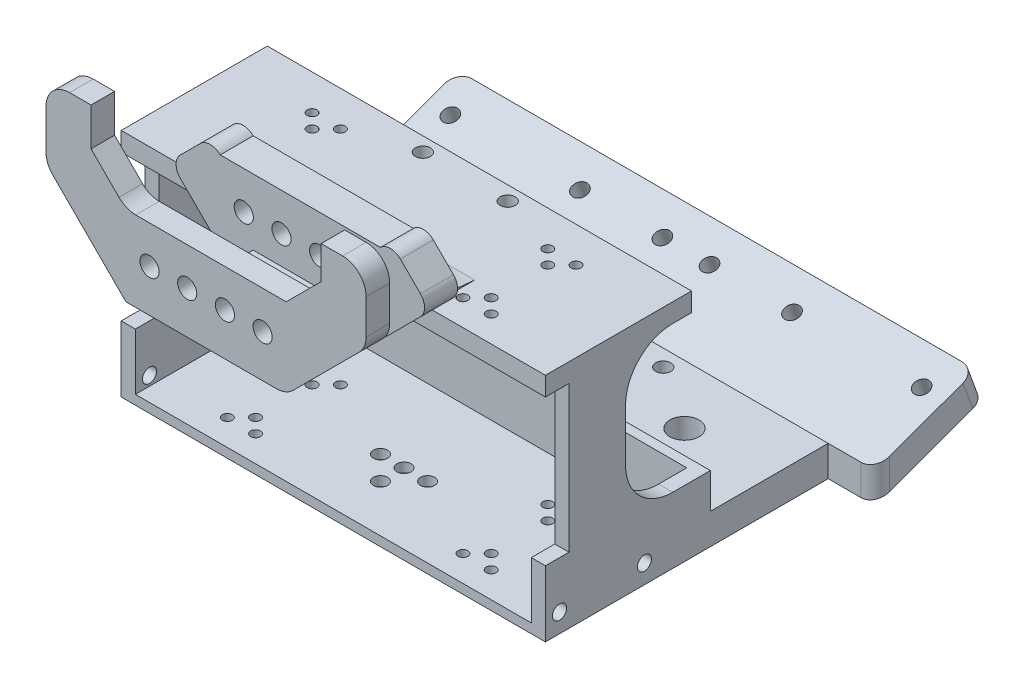
from build123d import *

# Parameters (mm, degrees)
EXTRUDE_1_DEPTH          = 4
EXTRUDE_2_DEPTH          = 7
EXTRUDE_3_DEPTH          = 15
EXTRUDE_4_DEPTH          = 5
CUT_EXTRUDE_2_REACH      = 93.694
SKETCH_6_R               = 2.03
EXTRUDE_5_DEPTH          = 31
EXTRUDE_6_DEPTH          = 12
EXTRUDE_7_DEPTH          = 2
CUT_EXTRUDE_3_DEPTH      = 103.59409284410384
CUT_EXTRUDE_3_DEPTH_BACK = 103.59409284410384
SKETCH_14_R              = 1.049999999999995
SKETCH_14_R_2            = 1.0499999999999985
SKETCH_14_R_3            = 1.049999999999999
SKETCH_14_R_4            = 1.0499999999999987
SKETCH_14_R_5            = 1.050000000000002
SKETCH_14_R_6            = 1.0499999999999916
FILLET_3_R               = 10
FILLET_5_R               = 5
FILLET_9_R               = 3
CUT_EXTRUDE_4_REACH      = 85.223
SKETCH_16_W              = 90.00000000000001
SKETCH_16_H              = 15
EXTRUDE_8_DEPTH          = 25
CUT_EXTRUDE_6_REACH      = 104.594
SKETCH_22_R              = 1.4999999999999998
SKETCH_22_R_2            = 1.4999999999999996
SKETCH_25_R              = 1.6000000000000019
CUT_EXTRUDE_7_DEPTH      = 4
EXTRUDE_10_DEPTH         = 20
EXTRUDE_11_DEPTH         = 55
CUT_EXTRUDE_8_REACH      = 123.772
SKETCH_31_R              = 1.5999999999999974
SKETCH_31_R_2            = 1.5999999999999983
SKETCH_31_R_3            = 1.6000000000000008
CUT_EXTRUDE_9_REACH      = 110.259
SKETCH_32_R              = 1.5999999999999992
SKETCH_32_R_2            = 1.6
SKETCH_32_R_3            = 1.6000000000000019
SKETCH_32_R_4            = 1.6000000000000008
SKETCH_32_R_5            = 3.0999999999999996
SKETCH_32_R_6            = 3.0999999999999983
FILLET_12_R              = 3
SKETCH_33_R              = 1.5000000000000004
SKETCH_33_R_2            = 1.5000000000000009
CUT_EXTRUDE_10_DEPTH     = 126.23705616521259


with BuildPart() as part:
    # 草图1 → 凸台-拉伸1 (new body)
    with BuildSketch(Plane(origin=(0, 0, 0), x_dir=(1, 0, 0), z_dir=(0, 1, 0))):
        Polygon((-45.000000000000014, 23), (44.999999999999986, 23), (45, -23), (-45.00000000000001, -23), align=None)
    extrude(amount=EXTRUDE_1_DEPTH)

    # 草图3 → 凸台-拉伸2 (add)
    with BuildSketch(Plane.XY.offset(23)):
        Polygon((-17, 0), (17, 0), (27.606601717798192, 10.606601717798231), (19.10660171779818, 19.106601717798203), (16.999999999999996, 17), (-17.000000000000004, 17), (-19.10660171779818, 19.106601717798203), (-27.606601717798192, 10.606601717798231), align=None)
    extrude(amount=EXTRUDE_2_DEPTH)

    # 草图4 → 凸台-拉伸3 (add)
    with BuildSketch(Plane.XY.offset(30)):
        Polygon((-9.999999999999934, 3.000000000000002), (10.000000000000068, 3.0000000000000013), (10.000000000000068, -1.8e-16), (-9.999999999999932, 1.07e-15), align=None)
    extrude(amount=EXTRUDE_3_DEPTH)

    # 草图5 → 凸台-拉伸4 (add)
    with BuildSketch(Plane.XY.offset(45)):
        Polygon((-33.9632034355964, 25.46320343559641), (-33.963203435596405, 32.46320343559642), (-24.4099025766973, 32.46320343559642), (-24.409902576697295, 24.409902576697302), (-19.10660171779818, 19.106601717798203), (-17.000000000000004, 17), (16.999999999999996, 17), (19.10660171779818, 19.106601717798203), (24.409902576697277, 24.40990257669732), (24.40990257669728, 31.40990257669732), (33.963203435596384, 31.40990257669732), (33.96320343559638, 25.463203435596437), (33.96320343559638, 16.963203435596416), (27.606601717798192, 10.606601717798231), (17, 0), (-17, 0), (-27.606601717798178, 10.60660171779821), (-33.9632034355964, 16.963203435596423), align=None)
    extrude(amount=EXTRUDE_4_DEPTH)

    # 切除-拉伸2: up to this face of the body (flat: up to its plane)
    cut_extrude_2_end = Plane(part.part.faces().sort_by_distance((0, 10.613576842, 23))[0])
    # 草图6 → 切除-拉伸2 (cut, up to the picked face)
    with BuildSketch(Plane.XY.offset(49.99999999999999), mode=Mode.PRIVATE) as cut_extrude_2_sk1:
        with Locations((-12.000000000000004, 9)):
            Circle(SKETCH_6_R)
    cut_extrude_2_tool1 = split(extrude(cut_extrude_2_sk1.sketch, amount=-CUT_EXTRUDE_2_REACH, mode=Mode.PRIVATE), bisect_by=cut_extrude_2_end, keep=Keep.BOTH, mode=Mode.PRIVATE)
    # 草图6 → 切除-拉伸2 (cut, up to the picked face)
    with BuildSketch(Plane.XY.offset(49.99999999999999), mode=Mode.PRIVATE) as cut_extrude_2_sk2:
        with Locations((-4.0000000000000036, 9)):
            Circle(SKETCH_6_R)
    cut_extrude_2_tool2 = split(extrude(cut_extrude_2_sk2.sketch, amount=-CUT_EXTRUDE_2_REACH, mode=Mode.PRIVATE), bisect_by=cut_extrude_2_end, keep=Keep.BOTH, mode=Mode.PRIVATE)
    # 草图6 → 切除-拉伸2 (cut, up to the picked face)
    with BuildSketch(Plane.XY.offset(49.99999999999999), mode=Mode.PRIVATE) as cut_extrude_2_sk3:
        with Locations((3.9999999999999964, 9)):
            Circle(SKETCH_6_R)
    cut_extrude_2_tool3 = split(extrude(cut_extrude_2_sk3.sketch, amount=-CUT_EXTRUDE_2_REACH, mode=Mode.PRIVATE), bisect_by=cut_extrude_2_end, keep=Keep.BOTH, mode=Mode.PRIVATE)
    # 草图6 → 切除-拉伸2 (cut, up to the picked face)
    with BuildSketch(Plane.XY.offset(49.99999999999999), mode=Mode.PRIVATE) as cut_extrude_2_sk4:
        with Locations((11.999999999999996, 9)):
            Circle(SKETCH_6_R)
    cut_extrude_2_tool4 = split(extrude(cut_extrude_2_sk4.sketch, amount=-CUT_EXTRUDE_2_REACH, mode=Mode.PRIVATE), bisect_by=cut_extrude_2_end, keep=Keep.BOTH, mode=Mode.PRIVATE)
    add(cut_extrude_2_tool1.solids().sort_by(Axis((-12, 9, 50), (0, 0, -1)))[0], mode=Mode.SUBTRACT)
    add(cut_extrude_2_tool2.solids().sort_by(Axis((-4, 9, 50), (0, 0, -1)))[0], mode=Mode.SUBTRACT)
    add(cut_extrude_2_tool3.solids().sort_by(Axis((4, 9, 50), (0, 0, -1)))[0], mode=Mode.SUBTRACT)
    add(cut_extrude_2_tool4.solids().sort_by(Axis((12, 9, 50), (0, 0, -1)))[0], mode=Mode.SUBTRACT)

    # 草图11 → 凸台-拉伸5 (add)
    with BuildSketch(Plane.XZ):
        Polygon((-45.000000000000014, 17.999999999999996), (-42.00000000000001, 18), (-42.00000000000001, 5.999999999999995), (-45.000000000000014, 5.999999999999995), align=None)
        Polygon((45.000000000000014, 6.000000000000006), (42.00000000000001, 6.000000000000005), (42.00000000000001, 18.00000000000001), (45.000000000000014, 18.000000000000007), align=None)
    extrude(amount=EXTRUDE_5_DEPTH)

    # 草图12 → 凸台-拉伸6 (add)
    with BuildSketch(Plane.XZ.offset(31)):
        Polygon((42.00000000000001, 23.000000000000004), (42, -10.000000000000004), (-42, -10.000000000000004), (-42.00000000000001, 23.000000000000004), (-45.00000000000001, 23), (-45.000000000000014, -12), (44.999999999999986, -12.000000000000004), (45, 22.999999999999996), align=None)
    extrude(amount=EXTRUDE_6_DEPTH)

    # 草图13 → 凸台-拉伸7 (add)
    with BuildSketch(Plane.XZ.offset(43)):
        Polygon((-45.00000000000001, 23), (44.99999999999999, 23), (44.99999999999999, -12.000000000000004), (-45, -12.000000000000004), align=None)
    extrude(amount=EXTRUDE_7_DEPTH)

    # 草图14 → 切除-拉伸3 (cut, two sides: drawn at the far end of the back side and taken through both)
    with BuildSketch(Plane.XZ.offset(45).offset(-CUT_EXTRUDE_3_DEPTH_BACK)):
        with Locations(Location((22.000000000000007, 17.499999999999993, 0), (0, 0, 270))):
            Circle(SKETCH_14_R)
        with Locations(Location((28, 17.499999999999996, 0), (0, 0, 270))):
            Circle(SKETCH_14_R_2)
        with Locations(Location((25, 14.499999999999995, 0), (0, 0, 270))):
            Circle(SKETCH_14_R_3)
        with Locations(Location((22.000000000000007, -0.5000000000000004, 0), (0, 0, 270))):
            Circle(SKETCH_14_R)
        with Locations(Location((25, 2.499999999999995, 0), (0, 0, 270))):
            Circle(SKETCH_14_R_4)
        with Locations(Location((28, -0.5000000000000039, 0), (0, 0, 270))):
            Circle(SKETCH_14_R_4)
        with Locations(Location((-28, -0.5000000000000108, 0), (0, 0, 270))):
            Circle(SKETCH_14_R_5)
        with Locations(Location((-22.000000000000007, -0.5000000000000059, 0), (0, 0, 270))):
            Circle(SKETCH_14_R_4)
        with Locations(Location((-25, 2.4999999999999893, 0), (0, 0, 270))):
            Circle(SKETCH_14_R_4)
        with Locations(Location((-22.000000000000007, 17.499999999999986, 0), (0, 0, 270))):
            Circle(SKETCH_14_R_6)
        with Locations(Location((-25, 14.49999999999999, 0), (0, 0, 270))):
            Circle(SKETCH_14_R_3)
        with Locations(Location((-28, 17.49999999999999, 0), (0, 0, 270))):
            Circle(SKETCH_14_R_2)
    extrude(amount=CUT_EXTRUDE_3_DEPTH + CUT_EXTRUDE_3_DEPTH_BACK, mode=Mode.SUBTRACT)

    # 圆角3
    fillet_3_edges = [part.edges().sort_by_distance(p)[0] for p in [
        (-43.500000000000014, 0, 5.999999999999995),
        (-43.500000000000014, -31, 5.999999999999995),
        (43.500000000000014, 0, 6.000000000000005),
        (43.500000000000014, -31, 6.000000000000005),
    ]]
    fillet(fillet_3_edges, radius=FILLET_3_R)

    # 圆角5
    fillet_5_edges = [part.edges().sort_by_distance(p)[0] for p in [
        (-17, 0, 26.5),
        (17, 0, 26.5),
        (17, 0, 47.5),
        (33.96320343559638, 16.963203435596416, 47.5),
        (33.963203435596384, 31.40990257669732, 47.5),
        (-17.000000000000004, 17, 47.5),
        (-33.963203435596405, 32.46320343559642, 47.5),
        (-33.9632034355964, 16.963203435596423, 47.5),
    ]]
    fillet(fillet_5_edges, radius=FILLET_5_R)

    # 圆角9
    # the kernel refuses this fillet: 3 mm, written as the material it takes off along each edge
    with BuildSketch(Plane(origin=(-27.606601717798192, 10.606601717798231, 15.499999999999998), x_dir=(0.7071067811865487, 0.7071067811865464, 0), z_dir=(0, 0, 1))) as fillet_9_piece_1:
        with BuildLine():
            CenterArc((FILLET_9_R, -FILLET_9_R), FILLET_9_R, 89.99999999999997, 90.00000000000003)
            Line((-1.28e-15, -FILLET_9_R), (0, 0))
            Line((0, 0), (FILLET_9_R, -6e-17))
        make_face()
    extrude(amount=22, mode=Mode.SUBTRACT)
    with BuildSketch(Plane(origin=(-19.10660171779818, 19.106601717798203, 15.499999999999972), x_dir=(0.7071067811865434, -0.7071067811865517, 0), z_dir=(0, 0, 1))) as fillet_9_piece_2_section:
        with BuildLine():
            CenterArc((FILLET_9_R, -FILLET_9_R), FILLET_9_R, 89.99999999999999, 90.00000000000023)
            Line((1.022e-14, -FILLET_9_R), (0, 0))
            Line((0, 0), (FILLET_9_R, -1e-17))
        make_face()
    fillet_9_piece_2 = extrude(amount=22.000000000000057, mode=Mode.PRIVATE)
    fillet_9_piece_2 = split(fillet_9_piece_2, bisect_by=Plane(origin=(-19.10660171779818, 17, 26.499999999999993), z_dir=(0, 1, 0)), keep=Keep.TOP, mode=Mode.PRIVATE)
    add(fillet_9_piece_2, mode=Mode.SUBTRACT)
    with BuildSketch(Plane(origin=(19.10660171779818, 19.106601717798203, 15.499999999999982), x_dir=(0.7071067811865493, -0.7071067811865458, 0), z_dir=(0, 0, 1))) as fillet_9_piece_3_section:
        with BuildLine():
            CenterArc((FILLET_9_R, -FILLET_9_R), FILLET_9_R, 89.99999999999999, 90.00000000000011)
            Line((7.49e-15, -FILLET_9_R), (0, 0))
            Line((0, 0), (FILLET_9_R, -9e-17))
        make_face()
    fillet_9_piece_3 = extrude(amount=22.000000000000032, mode=Mode.PRIVATE)
    fillet_9_piece_3 = split(fillet_9_piece_3, bisect_by=Plane(origin=(19.106601717798192, 17, 26.500000000000004), z_dir=(0, 1, 0)), keep=Keep.TOP, mode=Mode.PRIVATE)
    add(fillet_9_piece_3, mode=Mode.SUBTRACT)
    with BuildSketch(Plane(origin=(27.606601717798192, 10.606601717798231, 15.499999999999996), x_dir=(-0.7071067811865458, -0.7071067811865493, 0), z_dir=(0, 0, 1))) as fillet_9_piece_4:
        with BuildLine():
            CenterArc((FILLET_9_R, -FILLET_9_R), FILLET_9_R, 89.99999999999993, 90.00000000000007)
            Line((-3.72e-15, -FILLET_9_R), (0, 0))
            Line((0, 0), (FILLET_9_R, 2e-17))
        make_face()
    extrude(amount=22.000000000000004, mode=Mode.SUBTRACT)

    # 草图16 → 切除-拉伸4 (cut, up to next)
    with BuildSketch(Plane(origin=(0, 4, 0), x_dir=(1, 0, 0), z_dir=(0, 1, 0)), mode=Mode.PRIVATE) as cut_extrude_4_sk1:
        with Locations((-7.11e-15, 15.5)):
            Rectangle(SKETCH_16_W, SKETCH_16_H)
    cut_extrude_4_tool1 = extrude(cut_extrude_4_sk1.sketch, amount=-CUT_EXTRUDE_4_REACH, mode=Mode.PRIVATE) & part.part
    add(cut_extrude_4_tool1.solids().sort_by_distance((0, 4, -15.5))[0], mode=Mode.SUBTRACT)

    # 草图17 → 凸台-拉伸8 (add)
    with BuildSketch(Plane(origin=(0, 0, -12.000000000000004), x_dir=(-1, 0, 0), z_dir=(0, 0, -1))):
        Polygon((-44.99999999999999, -45), (45.00000000000001, -45), (45, -38.5), (-44.99999999999999, -38.5), align=None)
    extrude(amount=EXTRUDE_8_DEPTH)

    # 草图22 → 切除-拉伸6 (cut, up to next)
    with BuildSketch(Plane.XZ.offset(45), mode=Mode.PRIVATE) as cut_extrude_6_sk1:
        with Locations(Location((1.22e-15, 13.00000000000001, 0), (0, 0, 270))):
            Circle(SKETCH_22_R)
    cut_extrude_6_tool1 = extrude(cut_extrude_6_sk1.sketch, amount=-CUT_EXTRUDE_6_REACH, mode=Mode.PRIVATE) & part.part
    # 草图22 → 切除-拉伸6 (cut, up to next)
    with BuildSketch(Plane.XZ.offset(45), mode=Mode.PRIVATE) as cut_extrude_6_sk2:
        with Locations(Location((5.000000000000001, 8.00000000000001, 0), (0, 0, 270))):
            Circle(SKETCH_22_R_2)
    cut_extrude_6_tool2 = extrude(cut_extrude_6_sk2.sketch, amount=-CUT_EXTRUDE_6_REACH, mode=Mode.PRIVATE) & part.part
    # 草图22 → 切除-拉伸6 (cut, up to next)
    with BuildSketch(Plane.XZ.offset(45), mode=Mode.PRIVATE) as cut_extrude_6_sk3:
        with Locations(Location((1.22e-15, 8.00000000000001, 0), (0, 0, 270))):
            Circle(SKETCH_22_R)
    cut_extrude_6_tool3 = extrude(cut_extrude_6_sk3.sketch, amount=-CUT_EXTRUDE_6_REACH, mode=Mode.PRIVATE) & part.part
    # 草图22 → 切除-拉伸6 (cut, up to next)
    with BuildSketch(Plane.XZ.offset(45), mode=Mode.PRIVATE) as cut_extrude_6_sk4:
        with Locations(Location((-4.999999999999999, 8.00000000000001, 0), (0, 0, 270))):
            Circle(SKETCH_22_R)
    cut_extrude_6_tool4 = extrude(cut_extrude_6_sk4.sketch, amount=-CUT_EXTRUDE_6_REACH, mode=Mode.PRIVATE) & part.part
    add(cut_extrude_6_tool1.solids().sort_by_distance((0, -45, 13))[0], mode=Mode.SUBTRACT)
    add(cut_extrude_6_tool2.solids().sort_by_distance((5, -45, 8))[0], mode=Mode.SUBTRACT)
    add(cut_extrude_6_tool3.solids().sort_by_distance((0, -45, 8))[0], mode=Mode.SUBTRACT)
    add(cut_extrude_6_tool4.solids().sort_by_distance((-5, -45, 8))[0], mode=Mode.SUBTRACT)

    # 草图25 → 切除-拉伸7 (cut)
    with BuildSketch(Plane.XZ):
        with Locations(Location((-8.999999999999998, 22, 0), (0, 0, 270))):
            Circle(SKETCH_25_R)
        with Locations(Location((9, 22, 0), (0, 0, 270))):
            Circle(SKETCH_25_R)
        with Locations(Location((8.999999999999998, -5.000000000000002, 0), (0, 0, 270))):
            Circle(SKETCH_25_R)
        with Locations(Location((-8.999999999999998, -5.000000000000003, 0), (0, 0, 270))):
            Circle(SKETCH_25_R)
    extrude(amount=-CUT_EXTRUDE_7_DEPTH, mode=Mode.SUBTRACT)

    # 草图28 → 凸台-拉伸10 (add, symmetric)
    with BuildSketch(Plane(origin=(0, 0, 0), x_dir=(0, 0, -1), z_dir=(1, 0, 0))):
        Polygon((-23.000000000000004, 3.9999999999999947), (-13.000000000000004, 4), (-23.000000000000004, 4.999999999999995), align=None)
    extrude(amount=EXTRUDE_10_DEPTH, both=True)

    # 草图29 → 凸台-拉伸11 (add, symmetric)
    with BuildSketch(Plane(origin=(0, 0, 0), x_dir=(0, 0, -1), z_dir=(1, 0, 0))):
        Polygon((37.00000000000001, -38.5), (58.403255788166476, -30.709851976721644), (60.49231551964774, -36.44949641685835), (37.00000000000001, -45), align=None)
    extrude(amount=EXTRUDE_11_DEPTH, both=True)

    # 草图31 → 切除-拉伸8 (cut, up to next)
    with BuildSketch(Plane(origin=(0, -51.62757074937798, -18.790899020245863), x_dir=(1, 0, 0), z_dir=(0, -0.9396926207859094, -0.3420201433256659)), mode=Mode.PRIVATE) as cut_extrude_8_sk1:
        with Locations(Location((-49.99999999999999, -37.377720519423704, 0), (0, 0, 270))):
            Circle(SKETCH_31_R)
    cut_extrude_8_tool1 = extrude(cut_extrude_8_sk1.sketch, amount=-CUT_EXTRUDE_8_REACH, mode=Mode.PRIVATE) & part.part
    # 草图31 → 切除-拉伸8 (cut, up to next)
    with BuildSketch(Plane(origin=(0, -51.62757074937798, -18.790899020245863), x_dir=(1, 0, 0), z_dir=(0, -0.9396926207859094, -0.3420201433256659)), mode=Mode.PRIVATE) as cut_extrude_8_sk2:
        with Locations(Location((-4.999999999999999, -37.3777205194237, 0), (0, 0, 270))):
            Circle(SKETCH_31_R_2)
    cut_extrude_8_tool2 = extrude(cut_extrude_8_sk2.sketch, amount=-CUT_EXTRUDE_8_REACH, mode=Mode.PRIVATE) & part.part
    # 草图31 → 切除-拉伸8 (cut, up to next)
    with BuildSketch(Plane(origin=(0, -51.62757074937798, -18.790899020245863), x_dir=(1, 0, 0), z_dir=(0, -0.9396926207859094, -0.3420201433256659)), mode=Mode.PRIVATE) as cut_extrude_8_sk3:
        with Locations(Location((5.000000000000001, -37.3777205194237, 0), (0, 0, 270))):
            Circle(SKETCH_31_R_2)
    cut_extrude_8_tool3 = extrude(cut_extrude_8_sk3.sketch, amount=-CUT_EXTRUDE_8_REACH, mode=Mode.PRIVATE) & part.part
    # 草图31 → 切除-拉伸8 (cut, up to next)
    with BuildSketch(Plane(origin=(0, -51.62757074937798, -18.790899020245863), x_dir=(1, 0, 0), z_dir=(0, -0.9396926207859094, -0.3420201433256659)), mode=Mode.PRIVATE) as cut_extrude_8_sk4:
        with Locations(Location((50, -37.377720519423704, 0), (0, 0, 270))):
            Circle(SKETCH_31_R)
    cut_extrude_8_tool4 = extrude(cut_extrude_8_sk4.sketch, amount=-CUT_EXTRUDE_8_REACH, mode=Mode.PRIVATE) & part.part
    # 草图31 → 切除-拉伸8 (cut, up to next)
    with BuildSketch(Plane(origin=(0, -51.62757074937798, -18.790899020245863), x_dir=(1, 0, 0), z_dir=(0, -0.9396926207859094, -0.3420201433256659)), mode=Mode.PRIVATE) as cut_extrude_8_sk5:
        with Locations(Location((-22.5, -37.3777205194237, 0), (0, 0, 270))):
            Circle(SKETCH_31_R_3)
    cut_extrude_8_tool5 = extrude(cut_extrude_8_sk5.sketch, amount=-CUT_EXTRUDE_8_REACH, mode=Mode.PRIVATE) & part.part
    # 草图31 → 切除-拉伸8 (cut, up to next)
    with BuildSketch(Plane(origin=(0, -51.62757074937798, -18.790899020245863), x_dir=(1, 0, 0), z_dir=(0, -0.9396926207859094, -0.3420201433256659)), mode=Mode.PRIVATE) as cut_extrude_8_sk6:
        with Locations(Location((22.5, -37.3777205194237, 0), (0, 0, 270))):
            Circle(SKETCH_31_R_3)
    cut_extrude_8_tool6 = extrude(cut_extrude_8_sk6.sketch, amount=-CUT_EXTRUDE_8_REACH, mode=Mode.PRIVATE) & part.part
    add(cut_extrude_8_tool1.solids().sort_by_distance((-50, -38.843637, -53.914467))[0], mode=Mode.SUBTRACT)
    add(cut_extrude_8_tool2.solids().sort_by_distance((-5, -38.843637, -53.914467))[0], mode=Mode.SUBTRACT)
    add(cut_extrude_8_tool3.solids().sort_by_distance((5, -38.843637, -53.914467))[0], mode=Mode.SUBTRACT)
    add(cut_extrude_8_tool4.solids().sort_by_distance((50, -38.843637, -53.914467))[0], mode=Mode.SUBTRACT)
    add(cut_extrude_8_tool5.solids().sort_by_distance((-22.5, -38.843637, -53.914467))[0], mode=Mode.SUBTRACT)
    add(cut_extrude_8_tool6.solids().sort_by_distance((22.5, -38.843637, -53.914467))[0], mode=Mode.SUBTRACT)

    # 草图32 → 切除-拉伸9 (cut, up to next)
    with BuildSketch(Plane(origin=(0, -38.5, 0), x_dir=(1, 0, 0), z_dir=(0, 1, 0)), mode=Mode.PRIVATE) as cut_extrude_9_sk1:
        with Locations(Location((13.500000000000014, 33.5, 0), (0, 0, 270))):
            Circle(SKETCH_32_R)
    cut_extrude_9_tool1 = extrude(cut_extrude_9_sk1.sketch, amount=-CUT_EXTRUDE_9_REACH, mode=Mode.PRIVATE) & part.part
    # 草图32 → 切除-拉伸9 (cut, up to next)
    with BuildSketch(Plane(origin=(0, -38.5, 0), x_dir=(1, 0, 0), z_dir=(0, 1, 0)), mode=Mode.PRIVATE) as cut_extrude_9_sk2:
        with Locations(Location((13.500000000000014, 15.5, 0), (0, 0, 270))):
            Circle(SKETCH_32_R_2)
    cut_extrude_9_tool2 = extrude(cut_extrude_9_sk2.sketch, amount=-CUT_EXTRUDE_9_REACH, mode=Mode.PRIVATE) & part.part
    # 草图32 → 切除-拉伸9 (cut, up to next)
    with BuildSketch(Plane(origin=(0, -38.5, 0), x_dir=(1, 0, 0), z_dir=(0, 1, 0)), mode=Mode.PRIVATE) as cut_extrude_9_sk3:
        with Locations(Location((-13.499999999999984, 15.5, 0), (0, 0, 270))):
            Circle(SKETCH_32_R_3)
    cut_extrude_9_tool3 = extrude(cut_extrude_9_sk3.sketch, amount=-CUT_EXTRUDE_9_REACH, mode=Mode.PRIVATE) & part.part
    # 草图32 → 切除-拉伸9 (cut, up to next)
    with BuildSketch(Plane(origin=(0, -38.5, 0), x_dir=(1, 0, 0), z_dir=(0, 1, 0)), mode=Mode.PRIVATE) as cut_extrude_9_sk4:
        with Locations(Location((-13.499999999999988, 33.5, 0), (0, 0, 270))):
            Circle(SKETCH_32_R_4)
    cut_extrude_9_tool4 = extrude(cut_extrude_9_sk4.sketch, amount=-CUT_EXTRUDE_9_REACH, mode=Mode.PRIVATE) & part.part
    # 草图32 → 切除-拉伸9 (cut, up to next)
    with BuildSketch(Plane(origin=(0, -38.5, 0), x_dir=(1, 0, 0), z_dir=(0, 1, 0)), mode=Mode.PRIVATE) as cut_extrude_9_sk5:
        with Locations(Location((1.388e-14, 24.5, 0), (0, 0, 270))):
            Circle(SKETCH_32_R_5)
    cut_extrude_9_tool5 = extrude(cut_extrude_9_sk5.sketch, amount=-CUT_EXTRUDE_9_REACH, mode=Mode.PRIVATE) & part.part
    # 草图32 → 切除-拉伸9 (cut, up to next)
    with BuildSketch(Plane(origin=(0, -38.5, 0), x_dir=(1, 0, 0), z_dir=(0, 1, 0)), mode=Mode.PRIVATE) as cut_extrude_9_sk6:
        with Locations(Location((27.000000000000014, 24.5, 0), (0, 0, 270))):
            Circle(SKETCH_32_R_6)
    cut_extrude_9_tool6 = extrude(cut_extrude_9_sk6.sketch, amount=-CUT_EXTRUDE_9_REACH, mode=Mode.PRIVATE) & part.part
    # 草图32 → 切除-拉伸9 (cut, up to next)
    with BuildSketch(Plane(origin=(0, -38.5, 0), x_dir=(1, 0, 0), z_dir=(0, 1, 0)), mode=Mode.PRIVATE) as cut_extrude_9_sk7:
        with Locations(Location((-26.999999999999986, 24.5, 0), (0, 0, 270))):
            Circle(SKETCH_32_R_6)
    cut_extrude_9_tool7 = extrude(cut_extrude_9_sk7.sketch, amount=-CUT_EXTRUDE_9_REACH, mode=Mode.PRIVATE) & part.part
    add(cut_extrude_9_tool1.solids().sort_by_distance((13.5, -38.5, -33.5))[0], mode=Mode.SUBTRACT)
    add(cut_extrude_9_tool2.solids().sort_by_distance((13.5, -38.5, -15.5))[0], mode=Mode.SUBTRACT)
    add(cut_extrude_9_tool3.solids().sort_by_distance((-13.5, -38.5, -15.5))[0], mode=Mode.SUBTRACT)
    add(cut_extrude_9_tool4.solids().sort_by_distance((-13.5, -38.5, -33.5))[0], mode=Mode.SUBTRACT)
    add(cut_extrude_9_tool5.solids().sort_by_distance((0, -38.5, -24.5))[0], mode=Mode.SUBTRACT)
    add(cut_extrude_9_tool6.solids().sort_by_distance((27, -38.5, -24.5))[0], mode=Mode.SUBTRACT)
    add(cut_extrude_9_tool7.solids().sort_by_distance((-27, -38.5, -24.5))[0], mode=Mode.SUBTRACT)

    # 圆角12
    fillet_12_edges = [part.edges().sort_by_distance(p)[0] for p in [
        (-55, -41.75, -37.00000000000001),
        (-55, -33.579674196789995, -59.447785653907104),
        (55, -41.75, -37.00000000000001),
        (55, -33.579674196789995, -59.447785653907104),
    ]]
    fillet(fillet_12_edges, radius=FILLET_12_R)

    # 草图33 → 切除-拉伸10 (cut, through all)
    with BuildSketch(Plane(origin=(44.99999999999999, 0, -1.358e-14), x_dir=(-3e-16, 0, -1), z_dir=(1, 0, -3e-16))):
        with Locations((-2.0000000000000155, -40.99999999999999)):
            Circle(SKETCH_33_R)
        with Locations((-20.000000000000018, -40.99999999999999)):
            Circle(SKETCH_33_R_2)
    extrude(amount=-CUT_EXTRUDE_10_DEPTH, mode=Mode.SUBTRACT)


solid = part.part
